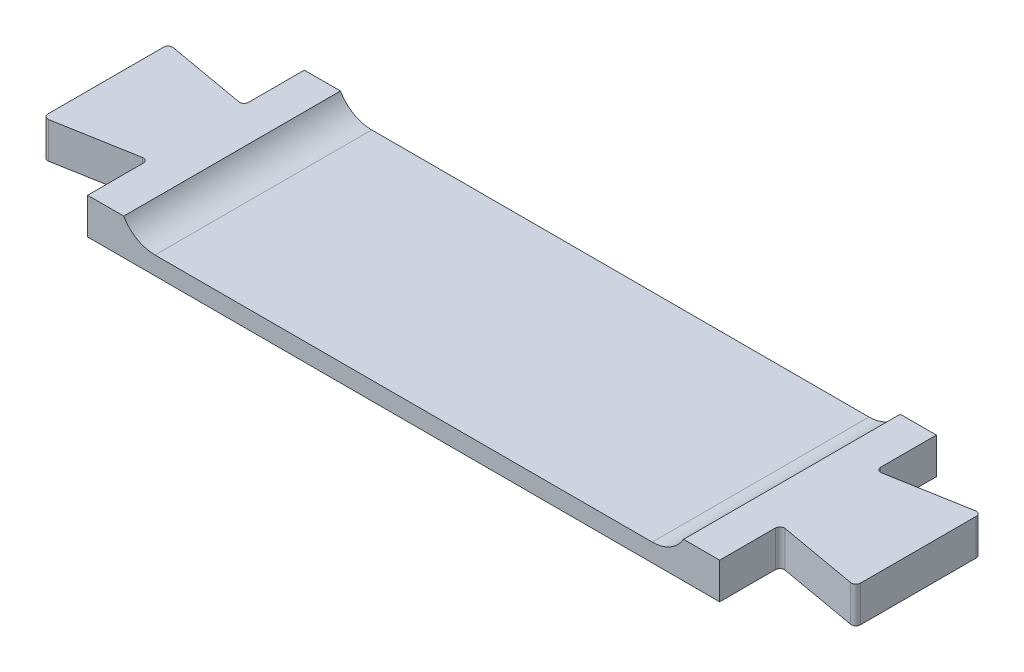
from build123d import *

# Parameters (mm, degrees)
BOSS_EXTRUDE1_DEPTH = 2
FILLET1_R           = 0.25
SKETCH3_W           = 31
SKETCH3_H           = 12
CUT_EXTRUDE2_DEPTH  = 1
FILLET6_R           = 2


with BuildPart() as part:
    # Sketch1 → Boss-Extrude1 (new body)
    with BuildSketch(Plane(origin=(0, 0, 0), x_dir=(1, 0, 0), z_dir=(0, 1, 0))):
        Polygon((-17.5, 2.618365096), (-22.5, 3.5), (-22.5, -3.5), (-17.5, -2.618365096), (-17.5, -6), (17.5, -6), (17.5, -2.618365096), (22.5, -3.5), (22.5, 3.5), (17.5, 2.618365096), (17.5, 6), (-17.5, 6), align=None)
    extrude(amount=BOSS_EXTRUDE1_DEPTH)

    # Fillet1
    fillet1_edges = [part.edges().sort_by_distance(p)[0] for p in [
        (17.5, 1, -2.618365096),
        (22.5, 1, -3.5),
        (22.5, 1, 3.5),
        (17.5, 1, 2.618365096),
        (-17.5, 1, 2.618365096),
        (-22.5, 1, 3.5),
        (-22.5, 1, -3.5),
        (-17.5, 1, -2.618365096),
    ]]
    fillet(fillet1_edges, radius=FILLET1_R)

    # Sketch3 → Cut-Extrude2 (cut)
    with BuildSketch(Plane(origin=(0, 2, 0), x_dir=(1, 0, 0), z_dir=(0, 1, 0))):
        Rectangle(SKETCH3_W, SKETCH3_H)
    extrude(amount=-CUT_EXTRUDE2_DEPTH, mode=Mode.SUBTRACT)

    # Fillet6
    # the kernel refuses this fillet: 2 mm, written as the material it adds along each edge
    with BuildSketch(Plane(origin=(-15.5, 1, 6), x_dir=(0, 1, 0), z_dir=(0, 0, -1))) as fillet6_piece_1:
        with BuildLine():
            CenterArc((2, 1.732050808), FILLET6_R, 180, 60)
            Line((0, 1.732050808), (-0.04, 1.732050808))
            Line((-0.04, 1.732050808), (-0.04, 0))
            Line((-0.04, 0), (0, -0.04))
            ThreePointArc((0, -0.04), (0.5, -0.04), (0.98, -0.034641016))
            Line((0.98, -0.034641016), (1, 0))
        make_face()
    extrude(amount=12)
    with BuildSketch(Plane(origin=(15.5, 1, -6), x_dir=(-1, 0, 0), z_dir=(0, 0, 1))) as fillet6_piece_2:
        with BuildLine():
            CenterArc((1.732050808, -2), FILLET6_R, 90, 60)
            Line((0, -1), (-0.034641016, -0.98))
            ThreePointArc((-0.034641016, -0.98), (-0.04, -0.5), (-0.04, 0))
            Line((-0.04, 0), (0, 0.04))
            Line((0, 0.04), (1.732050808, 0.04))
            Line((1.732050808, 0.04), (1.732050808, 0))
        make_face()
    extrude(amount=12)


solid = part.part
